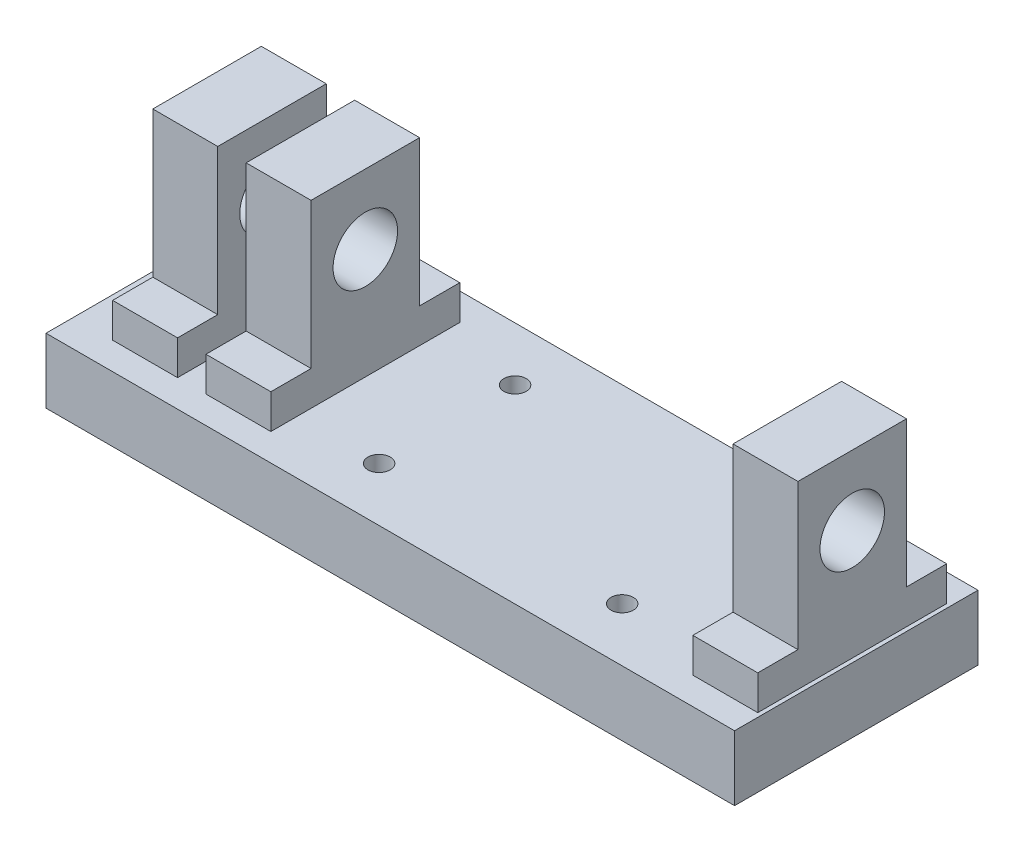
from build123d import *

# Parameters (mm, degrees)
SKETCH1_W           = 169.7
SKETCH1_H           = 60
SKETCH1_R           = 2.75
BOSS_EXTRUDE1_DEPTH = 16
BOSS_EXTRUDE2_START = -1
SKETCH2_R           = 7.95
BOSS_EXTRUDE2_DEPTH = 16
LPATTERN1_COUNT     = 2
LPATTERN1_PITCH     = 120
BOSS_EXTRUDE3_START = -144
SKETCH2_3_R         = 7.95
BOSS_EXTRUDE3_DEPTH = 16


with BuildPart() as part:
    # Sketch1 → Boss-Extrude1 (new body)
    with BuildSketch(Plane(origin=(0, 0, 0), x_dir=(1, 0, 0), z_dir=(0, 1, 0))):
        Rectangle(SKETCH1_W, SKETCH1_H)
        with Locations((-16, -16.75)):
            Circle(SKETCH1_R, mode=Mode.SUBTRACT)
        with Locations((43.9, -16.75)):
            Circle(SKETCH1_R, mode=Mode.SUBTRACT)
        with Locations((43.9, 16.75)):
            Circle(SKETCH1_R, mode=Mode.SUBTRACT)
        with Locations((-16, 16.75)):
            Circle(SKETCH1_R, mode=Mode.SUBTRACT)
    extrude(amount=BOSS_EXTRUDE1_DEPTH)

    # Sketch2 → Boss-Extrude2 (add)
    with BuildSketch(Plane(origin=(84.85, 0, 0), x_dir=(0, 0, -1), z_dir=(1, 0, 0)).offset(BOSS_EXTRUDE2_START)):
        Polygon((-23.280840018, 24.5), (-23.280840018, 16), (23.280840018, 16), (23.280840018, 24.5), (13.374099585, 24.5), (13.374099585, 60.4), (-13.374099585, 60.4), (-13.374099585, 24.5), align=None)
        with Locations((0, 43.25)):
            Circle(SKETCH2_R, mode=Mode.SUBTRACT)
    boss_extrude2 = extrude(amount=-BOSS_EXTRUDE2_DEPTH)

    # LPattern1: Boss-Extrude2 ×2
    with Locations(*[(-i * LPATTERN1_PITCH, 0, 0) for i in range(1, LPATTERN1_COUNT)]):
        add(boss_extrude2)

    # Sketch2<3> → Boss-Extrude3 (add)
    with BuildSketch(Plane(origin=(84.85, 0, 0), x_dir=(0, 0, -1), z_dir=(1, 0, 0)).offset(BOSS_EXTRUDE3_START)):
        Polygon((-23.280840018, 24.5), (-23.280840018, 16), (23.280840018, 16), (23.280840018, 24.5), (13.374099585, 24.5), (13.374099585, 60.4), (-13.374099585, 60.4), (-13.374099585, 24.5), align=None)
        with Locations((0, 43.25)):
            Circle(SKETCH2_3_R, mode=Mode.SUBTRACT)
    extrude(amount=-BOSS_EXTRUDE3_DEPTH)


solid = part.part
